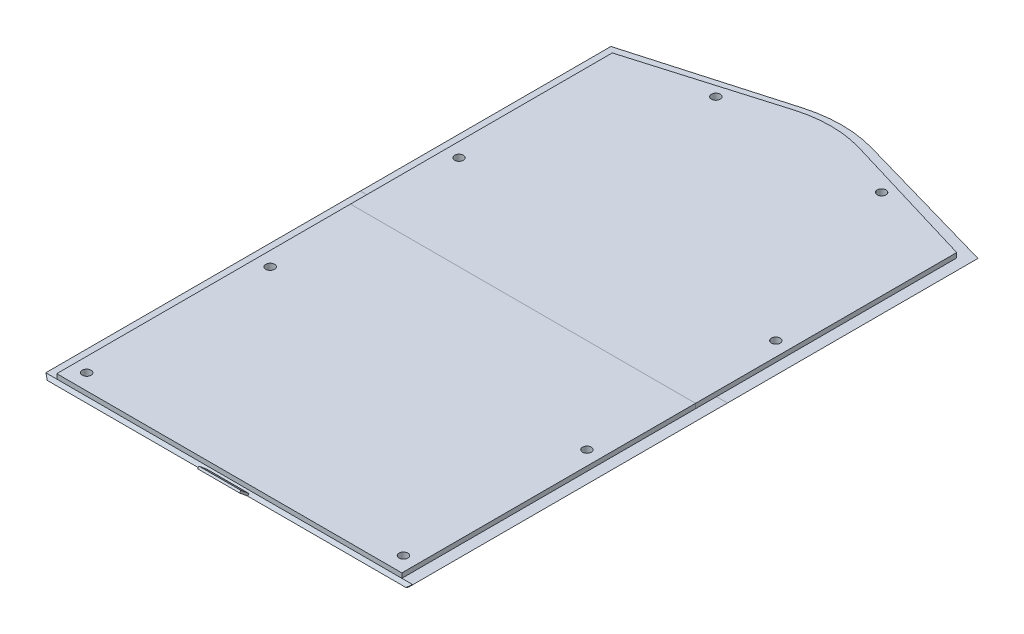
from build123d import *

# Parameters (mm, degrees)
BOSS_EXTRUDE1_DEPTH      = 2.25
BOSS_EXTRUDE2_DEPTH      = 2
CHAMFER1_SIZE            = 2
CUT_EXTRUDE1_REACH       = 177.436
SKETCH5_R                = 2.1
SPLIT1_SURFACE_1_BACK    = 341.45
SPLIT1_SURFACE_1_DEPTH   = 682.9
SPLIT1_SURFACE_2_BACK    = 341.45
SPLIT1_SURFACE_2_DEPTH   = 682.9
SKETCH7_R                = 2.25
BOSS_EXTRUDE3_DEPTH      = 2
CHAMFER2_SIZE            = 0.25
SKETCH9_R                = 2.5
CUT_EXTRUDE2_DEPTH       = 2
BOSS_EXTRUDE5_DEPTH      = 87.5
BOSS_EXTRUDE5_DEPTH_BACK = 87.5
CHAMFER3_SIZE            = 2
SKETCH13_W               = 20
SKETCH13_H               = 1
BOSS_EXTRUDE6_DEPTH      = 5


# Some blends are built 0.0001 mm under size
with BuildPart() as part:
    # Sketch3 → Boss-Extrude1 (new body)
    with BuildSketch(Plane.XZ):
        with BuildLine():
            Line((82.25, 140), (82.25, -124.502754064))
            Line((82.25, -124.502754064), (15.180121042, -144.629148882))
            ThreePointArc((15.180121042, -144.629148882), (7.687460253, -146.219552794), (0.046174732, -146.748803111))
            ThreePointArc((0.046174732, -146.748803111), (-7.595110788, -146.219552794), (-15.087771577, -144.629148882))
            Line((-15.087771577, -144.629148882), (-82.25, -124.813107271))
            Line((-82.25, -124.813107271), (-82.25, 140))
            Line((-82.25, 140), (82.25, 140))
        make_face()
    extrude(amount=-BOSS_EXTRUDE1_DEPTH)

    # Sketch4 → Boss-Extrude2 (add)
    with BuildSketch(Plane.XZ):
        with BuildLine():
            Line((87.5, 140), (-87.5, 140))
            Line((-87.5, 140), (-87.5, -129.399764523))
            Line((-87.5, -129.399764523), (-16.483267674, -149.690259473))
            ThreePointArc((-16.483267674, -149.690259473), (0, -151.998822615), (16.483267674, -149.690259473))
            Line((16.483267674, -149.690259473), (87.5, -129.399764523))
            Line((87.5, -129.399764523), (87.5, 140))
        make_face()
    extrude(amount=BOSS_EXTRUDE2_DEPTH)

    # Chamfer1
    chamfer1_edges = [part.edges().sort_by_distance(p)[0] for p in [
        (87.5, -2, 5.300117739),
        (51.991633837, -2, -139.545011998),
        (0, -2, -151.998822615),
        (-51.991633837, -2, -139.545011998),
        (-87.5, -2, 5.300117739),
    ]]
    chamfer(chamfer1_edges, length=CHAMFER1_SIZE - 0.0001)  # a hair under: the kernel refuses the full size

    # Sketch5 → Cut-Extrude1 (cut, up to next)
    with BuildSketch(Plane.XZ.offset(2), mode=Mode.PRIVATE) as cut_extrude1_sk1:
        with Locations(Location((39.5, -131.431881025, 0), (0, 0, 270))):
            Circle(SKETCH5_R)
    cut_extrude1_tool1 = extrude(cut_extrude1_sk1.sketch, amount=-CUT_EXTRUDE1_REACH, mode=Mode.PRIVATE) & part.part
    # Sketch5 → Cut-Extrude1 (cut, up to next)
    with BuildSketch(Plane.XZ.offset(2), mode=Mode.PRIVATE) as cut_extrude1_sk2:
        with Locations(Location((75.5, -45.018802154, 0), (0, 0, 270))):
            Circle(SKETCH5_R)
    cut_extrude1_tool2 = extrude(cut_extrude1_sk2.sketch, amount=-CUT_EXTRUDE1_REACH, mode=Mode.PRIVATE) & part.part
    # Sketch5 → Cut-Extrude1 (cut, up to next)
    with BuildSketch(Plane.XZ.offset(2), mode=Mode.PRIVATE) as cut_extrude1_sk3:
        with Locations(Location((75.5, 45.018802154, 0), (0, 0, 270))):
            Circle(SKETCH5_R)
    cut_extrude1_tool3 = extrude(cut_extrude1_sk3.sketch, amount=-CUT_EXTRUDE1_REACH, mode=Mode.PRIVATE) & part.part
    # Sketch5 → Cut-Extrude1 (cut, up to next)
    with BuildSketch(Plane.XZ.offset(2), mode=Mode.PRIVATE) as cut_extrude1_sk4:
        with Locations(Location((75.5, 132.481197846, 0), (0, 0, 270))):
            Circle(SKETCH5_R)
    cut_extrude1_tool4 = extrude(cut_extrude1_sk4.sketch, amount=-CUT_EXTRUDE1_REACH, mode=Mode.PRIVATE) & part.part
    # Sketch5 → Cut-Extrude1 (cut, up to next)
    with BuildSketch(Plane.XZ.offset(2), mode=Mode.PRIVATE) as cut_extrude1_sk5:
        with Locations(Location((-75.5, 132.481197846, 0), (0, 0, 270))):
            Circle(SKETCH5_R)
    cut_extrude1_tool5 = extrude(cut_extrude1_sk5.sketch, amount=-CUT_EXTRUDE1_REACH, mode=Mode.PRIVATE) & part.part
    # Sketch5 → Cut-Extrude1 (cut, up to next)
    with BuildSketch(Plane.XZ.offset(2), mode=Mode.PRIVATE) as cut_extrude1_sk6:
        with Locations(Location((-75.5, 45.018802154, 0), (0, 0, 270))):
            Circle(SKETCH5_R)
    cut_extrude1_tool6 = extrude(cut_extrude1_sk6.sketch, amount=-CUT_EXTRUDE1_REACH, mode=Mode.PRIVATE) & part.part
    # Sketch5 → Cut-Extrude1 (cut, up to next)
    with BuildSketch(Plane.XZ.offset(2), mode=Mode.PRIVATE) as cut_extrude1_sk7:
        with Locations(Location((-75.5, -45.018802154, 0), (0, 0, 270))):
            Circle(SKETCH5_R)
    cut_extrude1_tool7 = extrude(cut_extrude1_sk7.sketch, amount=-CUT_EXTRUDE1_REACH, mode=Mode.PRIVATE) & part.part
    # Sketch5 → Cut-Extrude1 (cut, up to next)
    with BuildSketch(Plane.XZ.offset(2), mode=Mode.PRIVATE) as cut_extrude1_sk8:
        with Locations(Location((-39.5, -131.431881025, 0), (0, 0, 270))):
            Circle(SKETCH5_R)
    cut_extrude1_tool8 = extrude(cut_extrude1_sk8.sketch, amount=-CUT_EXTRUDE1_REACH, mode=Mode.PRIVATE) & part.part
    add(cut_extrude1_tool1.solids().sort_by_distance((39.5, -2, -131.431881))[0], mode=Mode.SUBTRACT)
    add(cut_extrude1_tool2.solids().sort_by_distance((75.5, -2, -45.018802))[0], mode=Mode.SUBTRACT)
    add(cut_extrude1_tool3.solids().sort_by_distance((75.5, -2, 45.018802))[0], mode=Mode.SUBTRACT)
    add(cut_extrude1_tool4.solids().sort_by_distance((75.5, -2, 132.481198))[0], mode=Mode.SUBTRACT)
    add(cut_extrude1_tool5.solids().sort_by_distance((-75.5, -2, 132.481198))[0], mode=Mode.SUBTRACT)
    add(cut_extrude1_tool6.solids().sort_by_distance((-75.5, -2, 45.018802))[0], mode=Mode.SUBTRACT)
    add(cut_extrude1_tool7.solids().sort_by_distance((-75.5, -2, -45.018802))[0], mode=Mode.SUBTRACT)
    add(cut_extrude1_tool8.solids().sort_by_distance((-39.5, -2, -131.431881))[0], mode=Mode.SUBTRACT)


with BuildPart() as body_2:
    # Split1: the piece behind the surface
    add(part.part)
    # Split1 surface: a surface, the sketch's curves swept straight by 682.9 mm
    with BuildLine(Plane(origin=(0, 0, 0), x_dir=(0, 0, -1), z_dir=(1, 0, 0)).offset(-SPLIT1_SURFACE_1_BACK), mode=Mode.PRIVATE) as split1_surface_1_path:
        Line((10, -2), (10, 0))
        Line((10, 0), (0, 0))
        Line((0, 0), (0, 2.25))
    split1_surface_1 = Shell.extrude(split1_surface_1_path.wire(), (1 * SPLIT1_SURFACE_1_DEPTH, 0 * SPLIT1_SURFACE_1_DEPTH, 0 * SPLIT1_SURFACE_1_DEPTH))
    split(bisect_by=split1_surface_1, keep=Keep.BOTTOM)

    # Sketch7 → Boss-Extrude3 (add)
    with BuildSketch(Plane.XZ):
        with Locations(Location((72.25, -5, 0), (0, 0, 90))):
            Circle(SKETCH7_R)
        with Locations(Location((-72.25, -5, 0), (0, 0, 90))):
            Circle(SKETCH7_R)
    extrude(amount=BOSS_EXTRUDE3_DEPTH)

    # Chamfer2
    chamfer2_edges = [body_2.edges().sort_by_distance(p)[0] for p in [
        (72.25, -2, -7.25),
        (-72.25, -2, -7.25),
    ]]
    chamfer(chamfer2_edges, length=CHAMFER2_SIZE)


with BuildPart() as part_1:
    add(part.part)

    # Split1: split by a surface, the side it looks to stays
    # Split1 surface: a surface, the sketch's curves swept straight by 682.9 mm
    with BuildLine(Plane(origin=(0, 0, 0), x_dir=(0, 0, -1), z_dir=(1, 0, 0)).offset(-SPLIT1_SURFACE_2_BACK), mode=Mode.PRIVATE) as split1_surface_2_path:
        Line((10, -2), (10, 0))
        Line((10, 0), (0, 0))
        Line((0, 0), (0, 2.25))
    split1_surface_2 = Shell.extrude(split1_surface_2_path.wire(), (1 * SPLIT1_SURFACE_2_DEPTH, 0 * SPLIT1_SURFACE_2_DEPTH, 0 * SPLIT1_SURFACE_2_DEPTH))
    split(bisect_by=split1_surface_2, keep=Keep.TOP)

    # Sketch9 → Cut-Extrude2 (cut)
    with BuildSketch(Plane(origin=(0, 0, 0), x_dir=(1, 0, 0), z_dir=(0, 1, 0))):
        with Locations(Location((72.25, 5, 0), (0, 0, 270))):
            Circle(SKETCH9_R)
        with Locations(Location((-72.25, 5, 0), (0, 0, 90))):
            Circle(SKETCH9_R)
    extrude(amount=-CUT_EXTRUDE2_DEPTH, mode=Mode.SUBTRACT)

    # Sketch12 → Boss-Extrude5 (add, two sides: drawn at the far end of the back side and taken through both)
    with BuildSketch(Plane(origin=(0, 0, 0), x_dir=(0, 0, -1), z_dir=(1, 0, 0)).offset(-BOSS_EXTRUDE5_DEPTH_BACK)):
        Polygon((-140, -2), (-140, 0), (-141.280368799, -1.536442559), align=None)
    extrude(amount=BOSS_EXTRUDE5_DEPTH + BOSS_EXTRUDE5_DEPTH_BACK)

    # Chamfer3
    # the kernel refuses this chamfer: 2 mm, written as the material it takes off along each edge
    with BuildSketch(Plane(origin=(87.5, 0.21448916, 146.11652964), x_dir=(0.027495876610589054, 0.9399160769008188, -0.34029655471777764), z_dir=(0, -0.34042526375297005, -0.9402715776831292)), Plane(origin=(-87.5, 0.21448916, 146.11652964), x_dir=(0.999621916911297, -0.025853591280412175, 0.009360291047276351), z_dir=(0, -0.34042526375297005, -0.9402715776831292))) as chamfer3_piece_1:
        Polygon((CHAMFER3_SIZE * 0.999621916911, -CHAMFER3_SIZE * 0.0274958766106), (-CHAMFER3_SIZE * 0.0274958766106, -CHAMFER3_SIZE * 0.999621916911), (0, 0), align=None)
    extrude(amount=11.648433007, mode=Mode.SUBTRACT)

    # Sketch13 → Boss-Extrude6 (add)
    with BuildSketch(Plane(origin=(0, 68.852459016, 82.62295082), x_dir=(1, 0, 0), z_dir=(0, 0.6401843996644769, 0.7682212795973784))):
        with Locations((0, -91.125815953)):
            Rectangle(SKETCH13_W, SKETCH13_H)
    extrude(amount=BOSS_EXTRUDE6_DEPTH)


solid = Compound([body_2.part, part_1.part])
